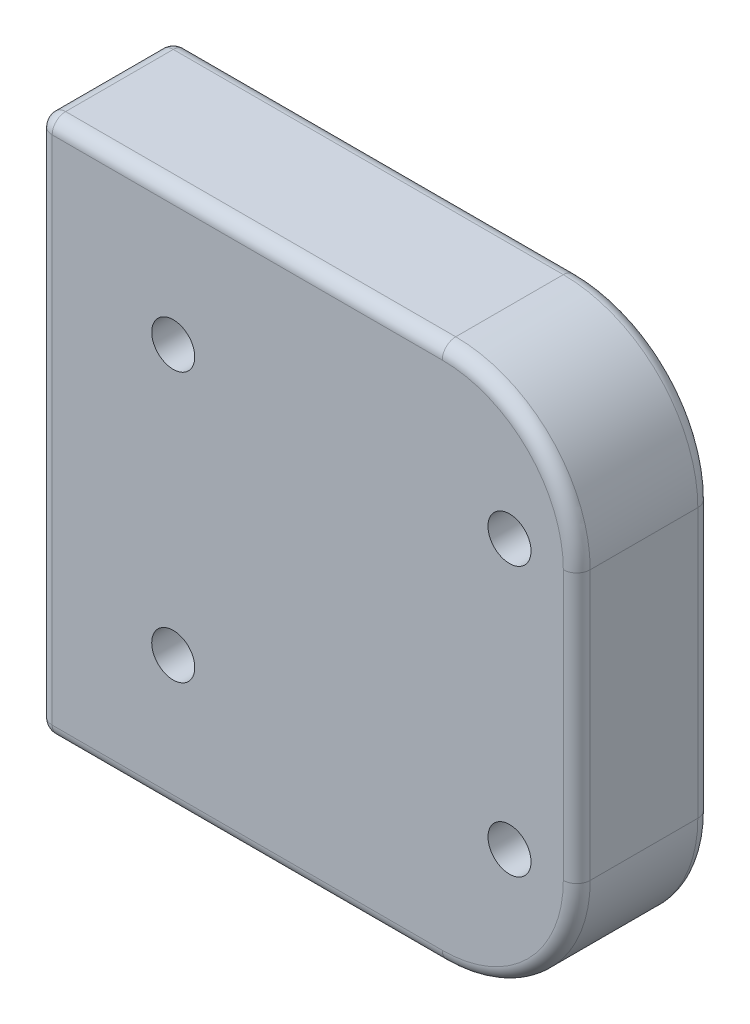
from build123d import *

# Parameters (mm, degrees)
SKETCH_1_W          = 40
SKETCH_1_H          = 40
EXTRUDE_1_DEPTH     = 10
SKETCH_2_R          = 1.6
CUT_EXTRUDE_1_DEPTH = 31
FILLET_1_R          = 10
FILLET_2_R          = 1


with BuildPart() as part:
    # 草图1 → 凸台-拉伸1 (new body)
    with BuildSketch(Plane.XY):
        Rectangle(SKETCH_1_W, SKETCH_1_H)
    extrude(amount=EXTRUDE_1_DEPTH)

    # 草图2 → 切除-拉伸1 (cut, through all)
    with BuildSketch(Plane.XY.offset(10)):
        with Locations((-10, 10)):
            Circle(SKETCH_2_R)
        with Locations((15, 10)):
            Circle(SKETCH_2_R)
        with Locations((15, -10)):
            Circle(SKETCH_2_R)
        with Locations((-10, -10)):
            Circle(SKETCH_2_R)
    extrude(amount=-CUT_EXTRUDE_1_DEPTH, mode=Mode.SUBTRACT)

    # 圆角1
    fillet_1_edges = [part.edges().sort_by_distance(p)[0] for p in [
        (20, -20, 5),
        (20, 20, 5),
    ]]
    fillet(fillet_1_edges, radius=FILLET_1_R)

    # 圆角2
    fillet_2_edges = [part.edges().sort_by_distance(p)[0] for p in [
        (-5, -20, 0),
        (-5, -20, 10),
        (-20, 0, 0),
        (-5, 20, 0),
        (-5, 20, 10),
        (-20, 0, 10),
        (-20, -20, 5),
        (-20, 20, 5),
        (17.071067812, -17.071067812, 0),
        (20, 0, 0),
        (17.071067812, 17.071067812, 0),
        (17.071067812, -17.071067812, 10),
        (20, 0, 10),
        (17.071067812, 17.071067812, 10),
    ]]
    fillet(fillet_2_edges, radius=FILLET_2_R)


solid = part.part
